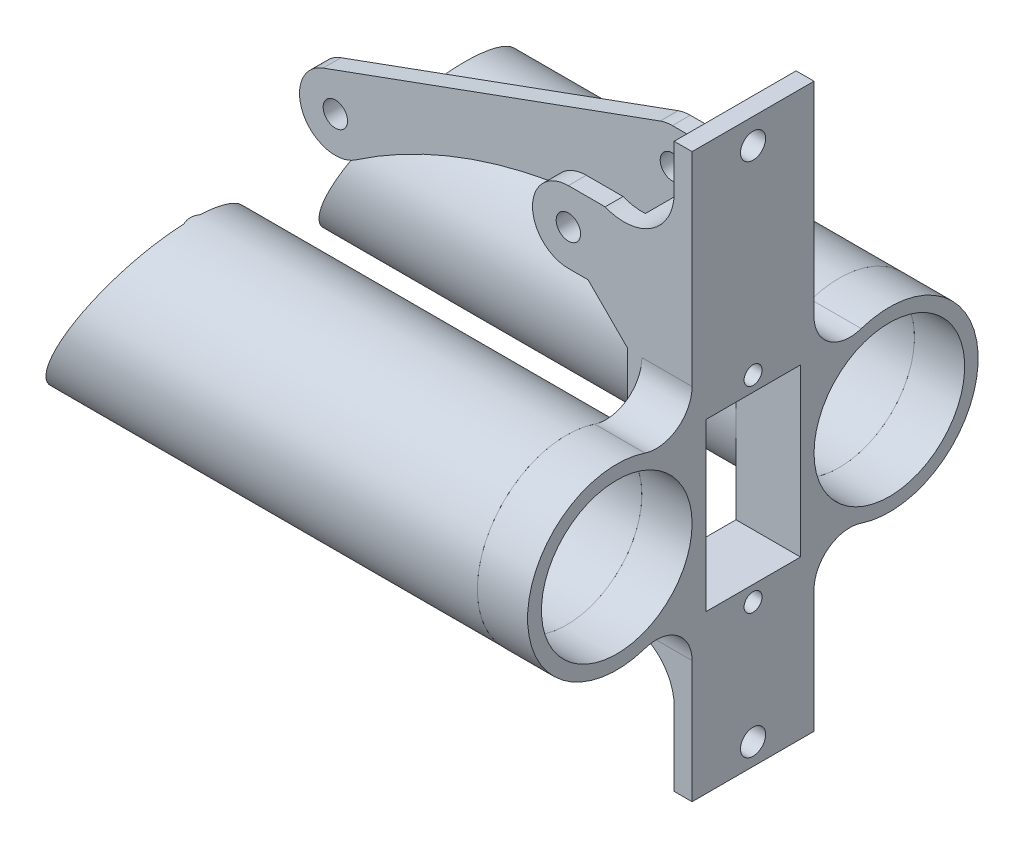
from build123d import *
from OCP.BRepFilletAPI import BRepFilletAPI_MakeChamfer

# Parameters (mm, degrees)
SKETCH_1_R          = 1.7
EXTRUDE_1_DEPTH     = 8.5
SKETCH_2_W          = 12
SKETCH_2_H          = 22.490317402
CUT_EXTRUDE_1_DEPTH = 17
SKETCH_3_W          = 17
SKETCH_3_H          = 48.5
SKETCH_3_R          = 1.25
SKETCH_3_W_2        = 13.183847054
SKETCH_3_H_2        = 23.198500104
EXTRUDE_2_DEPTH     = 2
CUT_EXTRUDE_2_DEPTH = 27
CHAMFER_1_SIZE      = 5.5
CHAMFER_1_SIZE2     = 5.4954286
SKETCH_5_R          = 10.5
SKETCH_5_R_2        = 1.25
SKETCH_5_W          = 13.183847054
SKETCH_5_H          = 23.198500104
EXTRUDE_3_DEPTH     = 7
SKETCH_6_R          = 12.433743537
SKETCH_6_R_2        = 10.5
EXTRUDE_4_DEPTH     = 65
SKETCH_6_R_3        = 12.382409409
EXTRUDE_4_2_DEPTH   = 65
CUT_EXTRUDE_3_DEPTH = 50
SKETCH_8_W          = 17
SKETCH_8_H          = 17.264216674
SKETCH_8_R          = 1.75
SKETCH_8_H_2        = 24.850413137
EXTRUDE_5_DEPTH     = 2.5
FILLET_START        = -8.5
FILLET_1_DEPTH      = 17
FILLET_1_2_DEPTH    = 2.5
FILLET_START_2      = 6
FILLET_1_3_DEPTH    = 2.5
FILLET_2_R          = 5
SKETCH_9_R          = 1.7
EXTRUDE_6_DEPTH     = 2.5
CUT_EXTRUDE_6_DEPTH = 49
SKETCH_13_W         = 3.687301031
SKETCH_13_H         = 25.158467393
CUT_EXTRUDE_7_DEPTH = 49


with BuildPart() as part:
    # 草图1 → 凸台-拉伸1 (new, symmetric)
    with BuildSketch(Plane.XY):
        with BuildLine():
            Line((-174.662698808, -126), (-166.418250776, -126))
            Line((-166.418250776, -126), (-166.418250776, -135.993140688))
            Line((-166.418250776, -135.993140688), (-174.658537801, -135.999998269))
            ThreePointArc((-174.658537801, -135.999998269), (-179.662698375, -131.002080504), (-174.662698808, -126))
        make_face()
        with Locations((-174.662698808, -131)):
            Circle(SKETCH_1_R, mode=Mode.SUBTRACT)
    extrude(amount=EXTRUDE_1_DEPTH, both=True)

    # 草图2 → 切除-拉伸1 (cut)
    with BuildSketch(Plane(origin=(-166.418250776, 0, 0), x_dir=(0, 0, -1), z_dir=(1, 0, 0))):
        with Locations((0, -126)):
            Rectangle(SKETCH_2_W, SKETCH_2_H)
    extrude(amount=-CUT_EXTRUDE_1_DEPTH, mode=Mode.SUBTRACT)


with BuildPart() as cut_extrude_1_piece_1:
    # of the separate pieces the step leaves, piece 1, a body of its own (cut_extrude_1_pieces)
    add(part.part.solids().sort_by_distance((-174.662698808, -126, 6))[0])



with BuildPart() as cut_extrude_1_piece_2:
    # of the separate pieces the step leaves, piece 2, a body of its own (cut_extrude_1_pieces)
    add(part.part.solids().sort_by_distance((-174.662698808, -126, -8.5))[0])


with BuildPart() as cut_extrude_1_piece_1_1:
    add(cut_extrude_1_piece_1.part)

    add(cut_extrude_1_piece_2.part)  # 凸台-拉伸2 merges 切除-拉伸1 piece 2
    # 草图3 → 凸台-拉伸2 (add)
    with BuildSketch(Plane(origin=(-166.418250776, 0, 0), x_dir=(0, 0, -1), z_dir=(1, 0, 0))):
        with Locations((0, -150.25)):
            Rectangle(SKETCH_3_W, SKETCH_3_H)
        with Locations((0, -144.496752449)):
            Circle(SKETCH_3_R, mode=Mode.SUBTRACT)
        with Locations((0, -171.896752449)):
            Circle(SKETCH_3_R, mode=Mode.SUBTRACT)
        with Locations((0.025667064, -158.178609239)):
            Rectangle(SKETCH_3_W_2, SKETCH_3_H_2, mode=Mode.SUBTRACT)
    extrude(amount=EXTRUDE_2_DEPTH)

    # 草图4 → 切除-拉伸2 (cut)
    with BuildSketch(Plane(origin=(0, 0, -8.5), x_dir=(-1, 0, 0), z_dir=(0, 0, -1))):
        Polygon((169.540474792, -126), (164.418250776, -131.122224016), (164.418250776, -126), align=None)
    extrude(amount=-CUT_EXTRUDE_2_DEPTH, mode=Mode.SUBTRACT)

    # 倒角1: one chamfer whose edges measure the first distance from different faces: ONE call of the kernel's chamfer builder (chamfer() names one face for all edges)
    chamfer_1_edges_1 = [cut_extrude_1_piece_1_1.edges().sort_by_distance(p)[0] for p in [
        (-166.418250776, -135.993140688, -7.25),
    ]]
    chamfer_1_side_1 = [cut_extrude_1_piece_1_1.faces().sort_by_distance(p)[0] for p in [
        (-170.538394288, -135.996569478, -7.25),
    ]]
    chamfer_1_edges_2 = [cut_extrude_1_piece_1_1.edges().sort_by_distance(p)[0] for p in [
        (-166.418250776, -135.993140688, 7.25),
    ]]
    chamfer_1_side_2 = [cut_extrude_1_piece_1_1.faces().sort_by_distance(p)[0] for p in [
        (-170.538394288, -135.996569478, 7.25),
    ]]
    chamfer_1 = BRepFilletAPI_MakeChamfer(cut_extrude_1_piece_1_1.part.solid().wrapped)
    for e in chamfer_1_edges_1:
        chamfer_1.Add(CHAMFER_1_SIZE, CHAMFER_1_SIZE2, e.wrapped, chamfer_1_side_1[0].wrapped)  # the first distance lies on this face
    for e in chamfer_1_edges_2:
        chamfer_1.Add(CHAMFER_1_SIZE, CHAMFER_1_SIZE2, e.wrapped, chamfer_1_side_2[0].wrapped)  # the first distance lies on this face
    add(Compound.cast(chamfer_1.Shape()), mode=Mode.REPLACE)

    # 草图5 → 凸台-拉伸3 (add)
    with BuildSketch(Plane(origin=(-164.418250776, 0, 0), x_dir=(0, 0, -1), z_dir=(1, 0, 0))):
        with BuildLine():
            Line((-8.5, -164.838037019), (-8.5, -174.5))
            Line((-8.5, -174.5), (8.5, -174.5))
            Line((8.5, -174.5), (8.5, -164.741692568))
            ThreePointArc((8.5, -164.741692568), (31.382409409, -158.178609239), (8.5, -151.61552591))
            Line((8.5, -151.61552591), (8.5, -131.122224016))
            Line((8.5, -131.122224016), (-8.5, -131.122224016))
            Line((-8.5, -131.122224016), (-8.5, -151.519181459))
            ThreePointArc((-8.5, -151.519181459), (-31.433743537, -158.178609239), (-8.5, -164.838037019))
        make_face()
        with Locations((-19, -158.178609239)):
            Circle(SKETCH_5_R, mode=Mode.SUBTRACT)
        with Locations(Location((19, -158.178609239, 0), (0, 0, 180))):
            Circle(SKETCH_5_R, mode=Mode.SUBTRACT)
        with Locations((0, -171.896752449)):
            Circle(SKETCH_5_R_2, mode=Mode.SUBTRACT)
        with Locations((0, -144.496752449)):
            Circle(SKETCH_5_R_2, mode=Mode.SUBTRACT)
        with Locations((0.025667064, -158.178609239)):
            Rectangle(SKETCH_5_W, SKETCH_5_H, mode=Mode.SUBTRACT)
    extrude(amount=EXTRUDE_3_DEPTH)

    # 草图7 → 切除-拉伸3 (cut)
    with BuildSketch(Plane(origin=(0, 0, -8.5), x_dir=(-1, 0, 0), z_dir=(0, 0, -1))):
        Polygon((164.418250776, -131.122224016), (157.418250776, -138.122224016), (157.418250776, -131.122224016), align=None)
    extrude(amount=-CUT_EXTRUDE_3_DEPTH, mode=Mode.SUBTRACT)

    # 草图8 → 凸台-拉伸5 (add)
    # profile 1 of 2: a face of its own
    with BuildSketch(Plane(origin=(-157.418250776, 0, 0), x_dir=(0, 0, -1), z_dir=(1, 0, 0))):
        with Locations((0, -183.132108337)):
            Rectangle(SKETCH_8_W, SKETCH_8_H)
        with Locations((0, -188.764216674)):
            Circle(SKETCH_8_R, mode=Mode.SUBTRACT)
    # profile 2 of 2: a face of its own
    with BuildSketch(Plane(origin=(-157.418250776, 0, 0), x_dir=(0, 0, -1), z_dir=(1, 0, 0))):
        with Locations((0, -125.697017448)):
            Rectangle(SKETCH_8_W, SKETCH_8_H_2)
        with Locations((0, -116.802352716)):
            Circle(SKETCH_8_R, mode=Mode.SUBTRACT)
    extrude(amount=-EXTRUDE_5_DEPTH)

    # 圆角1: read off the stored shape, not the designer's step
    # 圆角1 outline → 圆角1 (add)
    with BuildSketch(Plane.XY.offset(FILLET_START)):
        with BuildLine():
            Line((-159.918250776, -174.5), (-166.418250776, -174.5))
            ThreePointArc((-166.418250776, -174.5), (-161.794775393, -176.712424015), (-159.918250776, -181.482120022))
            Line((-159.918250776, -181.482120022), (-159.918250776, -174.5))
        make_face()
        with BuildLine():
            Line((-166.418250776, -126.491824096), (-166.418250776, -129.122224016))
            Line((-166.418250776, -129.122224016), (-159.918250776, -135.622224016))
            Line((-159.918250776, -135.622224016), (-159.918250776, -119.509704074))
            ThreePointArc((-159.918250776, -119.509704074), (-161.794775393, -124.279400081), (-166.418250776, -126.491824096))
        make_face()
    extrude(amount=FILLET_1_DEPTH)

    # Fillet 1 2 outline → Fillet 1 2 (add)
    with BuildSketch(Plane.XY.offset(FILLET_START)):
        with BuildLine():
            Line((-169.540474792, -126), (-166.418250776, -129.122224016))
            Line((-166.418250776, -129.122224016), (-166.418250776, -126.491824096))
            ThreePointArc((-166.418250776, -126.491824096), (-168.007485107, -126.424439685), (-169.540474792, -126))
        make_face()
    extrude(amount=FILLET_1_2_DEPTH)

    # Fillet 1 3 outline → Fillet 1 3 (add)
    with BuildSketch(Plane.XY.offset(FILLET_START_2)):
        with BuildLine():
            Line((-169.540474792, -126), (-166.418250776, -129.122224016))
            Line((-166.418250776, -129.122224016), (-166.418250776, -126.491824096))
            ThreePointArc((-166.418250776, -126.491824096), (-168.007485107, -126.424439685), (-169.540474792, -126))
        make_face()
    extrude(amount=FILLET_1_3_DEPTH)

    # 圆角2
    fillet_2_edges = [cut_extrude_1_piece_1_1.edges().sort_by_distance(p)[0] for p in [
        (-160.918250776, -164.838037019, 8.5),
        (-160.918250776, -151.519181459, 8.5),
        (-160.918250776, -151.61552591, -8.5),
        (-160.918250776, -164.741692568, -8.5),
    ]]
    fillet(fillet_2_edges, radius=FILLET_2_R)

    # 草图9 → 凸台-拉伸6 (add)
    with BuildSketch(Plane(origin=(0, 0, -8.5), x_dir=(-1, 0, 0), z_dir=(0, 0, -1))):
        with BuildLine():
            Line((223.357430564, -143.402544062), (176.372799524, -126.301536896))
            ThreePointArc((176.372799524, -126.301536896), (179.586375871, -131.870289709), (174.658537801, -135.999998269))
            Line((174.658537801, -135.999998269), (171.918248871, -135.997717796))
            Line((171.918248871, -135.997717796), (166.418250776, -141.488569288))
            ThreePointArc((166.418250776, -141.488569288), (193.703161063, -141.590737418), (218.828279725, -152.230529706))
            ThreePointArc((218.828279725, -152.230529706), (226.096012217, -150.383379873), (223.357430564, -143.402544062))
        make_face()
        with Locations((221.647329847, -148.101007166)):
            Circle(SKETCH_9_R, mode=Mode.SUBTRACT)
    extrude(amount=-EXTRUDE_6_DEPTH)


with BuildPart() as body_2:
    # 草图6 → 凸台-拉伸4 (new body)
    with BuildSketch(Plane.ZY.offset(164.418250776)):
        with Locations((19, -158.178609239)):
            Circle(SKETCH_6_R)
        with Locations((19, -158.178609239)):
            Circle(SKETCH_6_R_2, mode=Mode.SUBTRACT)
    extrude(amount=EXTRUDE_4_DEPTH)


with BuildPart() as body_3:
    # 草图6 → Extrude 4 2 (new body)
    with BuildSketch(Plane.ZY.offset(164.418250776)):
        with Locations((-19, -158.178609239)):
            Circle(SKETCH_6_R_3)
        with Locations((-19, -158.178609239)):
            Circle(SKETCH_6_R_2, mode=Mode.SUBTRACT)
    extrude(amount=EXTRUDE_4_2_DEPTH)


with BuildPart() as cut_extrude_6_tool:
    # 草图12 → 切除-拉伸6 (new, symmetric)
    with BuildSketch(Plane(origin=(0, 0, -8.5), x_dir=(-1, 0, 0), z_dir=(0, 0, -1))):
        Polygon((216.629032078, -145.79619983), (229.418250776, -170.612352776), (229.418250776, -143.397590388), align=None)
    extrude(amount=CUT_EXTRUDE_6_DEPTH, both=True)


with BuildPart() as body_3_1:
    add(body_3.part)

    # 切除-拉伸6: cut by cut_extrude_6_tool
    add(cut_extrude_6_tool.part, mode=Mode.SUBTRACT)


with BuildPart() as body_2_1:
    add(body_2.part)

    # 切除-拉伸6: cut by cut_extrude_6_tool
    add(cut_extrude_6_tool.part, mode=Mode.SUBTRACT)


with BuildPart() as cut_extrude_7_tool:
    # 草图13 → 切除-拉伸7 (new, symmetric)
    with BuildSketch(Plane(origin=(0, 0, -8.5), x_dir=(-1, 0, 0), z_dir=(0, 0, -1))):
        with Locations((229.064220935, -160.680240862)):
            Rectangle(SKETCH_13_W, SKETCH_13_H)
    extrude(amount=CUT_EXTRUDE_7_DEPTH, both=True)


with BuildPart() as body_2_2:
    add(body_2_1.part)

    # 切除-拉伸7: cut by cut_extrude_7_tool
    add(cut_extrude_7_tool.part, mode=Mode.SUBTRACT)


with BuildPart() as body_3_2:
    add(body_3_1.part)

    # 切除-拉伸7: cut by cut_extrude_7_tool
    add(cut_extrude_7_tool.part, mode=Mode.SUBTRACT)


solid = Compound([cut_extrude_1_piece_1_1.part, body_2_2.part, body_3_2.part])
